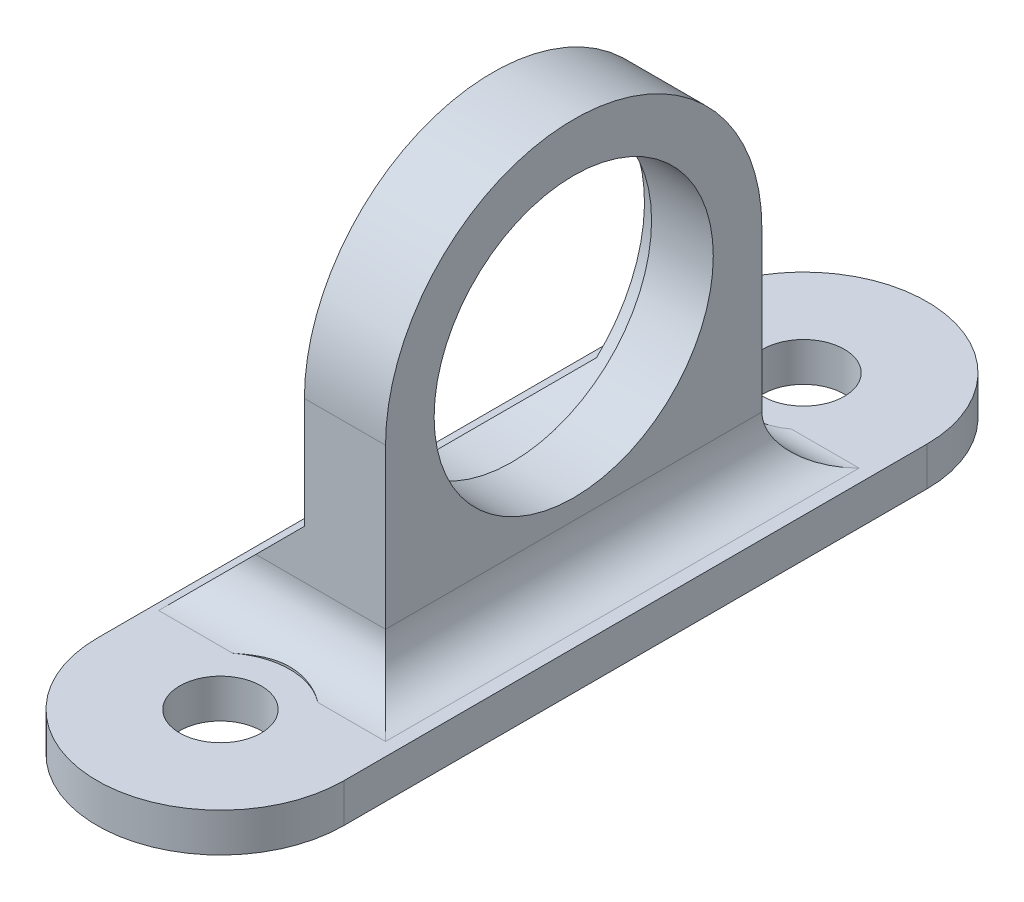
from build123d import *

# Parameters (mm, degrees)
SKETCH1_R                          = 19.3637
SKETCH1_R_2                        = 14.3637
MOTOR_FACE_AND_SCREW_EXTRUDE_DEPTH = 6.35
BOSS_EXTRUDE4_START                = 2
SKETCH7_R                          = 19.3637
SKETCH7_R_2                        = 15.6337
BOSS_EXTRUDE4_DEPTH                = 2
SKETCH3_R                          = 4.2
BOSS_EXTRUDE3_DEPTH                = 4
BOSS_EXTRUDE5_REACH                = 62.384
BOSS_EXTRUDE5_END_RADIUS           = 19.3637
SKETCH8_W                          = 8.35
SKETCH8_H                          = 38.7274
CHAMFER1_SIZE                      = 10
FILLET1_R                          = 5
SKETCH6_W                          = 7.14375
SKETCH6_H                          = 40.7637
F_1_0MM_DOWEL_HOLE1_AT_2_COUNT     = 2
F_1_0MM_DOWEL_HOLE1_AT_2_PITCH     = 60


with BuildPart() as part:
    # Sketch1 → Motor face and screw extrude (new body)
    with BuildSketch(Plane(origin=(0, 0, 0), x_dir=(0, 0, -1), z_dir=(1, 0, 0))):
        with Locations((0, -7)):
            Circle(SKETCH1_R)
        with Locations((0, -7)):
            Circle(SKETCH1_R_2, mode=Mode.SUBTRACT)
    extrude(amount=MOTOR_FACE_AND_SCREW_EXTRUDE_DEPTH)

    # Sketch7 → Boss-Extrude4 (add)
    with BuildSketch(Plane.ZY.offset(BOSS_EXTRUDE4_START)):
        with Locations((0, -7)):
            Circle(SKETCH7_R)
        with Locations((0, -7)):
            Circle(SKETCH7_R_2, mode=Mode.SUBTRACT)
    extrude(amount=-BOSS_EXTRUDE4_DEPTH)



with BuildPart() as body_2:
    # Sketch3 → Boss-Extrude3 (new body)
    with BuildSketch(Plane(origin=(0, -32.4, 0), x_dir=(1, 0, 0), z_dir=(0, 1, 0))):
        with BuildLine():
            Line((-12.7, -30), (-12.7, 30))
            ThreePointArc((-12.7, 30), (0, 42.7), (12.7, 30))
            Line((12.7, 30), (12.7, -30))
            ThreePointArc((12.7, -30), (0, -42.7), (-12.7, -30))
        make_face()
        with Locations(Location((0, 30, 0), (0, 0, 270))):
            Circle(SKETCH3_R, mode=Mode.SUBTRACT)
        with Locations(Location((0, -30, 0), (0, 0, 90))):
            Circle(SKETCH3_R, mode=Mode.SUBTRACT)
    extrude(amount=BOSS_EXTRUDE3_DEPTH)


with BuildPart() as part_1:
    add(part.part)

    add(body_2.part)  # Boss-Extrude5 merges body 2
    # Boss-Extrude5: up to this cylinder (the profile starts outside it)
    boss_extrude5_end = Plane(origin=(2.175, -7, 0), z_dir=(-1, 0, 0)) * Cylinder(BOSS_EXTRUDE5_END_RADIUS, 164.4954, mode=Mode.PRIVATE)
    # Sketch8 → Boss-Extrude5 (add, up to the surface)
    with BuildSketch(Plane(origin=(0, -28.4, 0), x_dir=(1, 0, 0), z_dir=(0, 1, 0)), mode=Mode.PRIVATE) as boss_extrude5_sk1:
        with Locations((2.175, 0)):
            Rectangle(SKETCH8_W, SKETCH8_H)
    boss_extrude5_tool1 = extrude(boss_extrude5_sk1.sketch, amount=BOSS_EXTRUDE5_REACH, mode=Mode.PRIVATE) - boss_extrude5_end
    add(boss_extrude5_tool1.solids().sort_by_distance((2.175, -28.4, 0))[0])

    # Chamfer1
    # the kernel refuses this chamfer: 10 mm, written as the material it adds along each edge
    with BuildSketch(Plane(origin=(-2, -28.4, -19.3637), x_dir=(-0.9996219169112968, -0.027495876610586317, 0), z_dir=(0, 0, 1))) as chamfer1_piece_1_section:
        Polygon((CHAMFER1_SIZE * 0.999621916911, -CHAMFER1_SIZE * 0.0274958766106), (-CHAMFER1_SIZE * 0.0274958766106, -CHAMFER1_SIZE * 0.999621916911), (0, 0), align=None)
    chamfer1_piece_1 = extrude(amount=38.7274, mode=Mode.PRIVATE)
    chamfer1_piece_1 = chamfer1_piece_1 - Plane(origin=(-3.620762983, -7, 0), x_dir=(0, 0, 1), z_dir=(-1, 0, 0)) * Cylinder(15.6337, 118, mode=Mode.PRIVATE)
    add(chamfer1_piece_1)

    # Fillet1
    fillet1_edges = [part_1.edges().sort_by_distance(p)[0] for p in [
        (-2.825, -28.4, -19.3637),
        (6.35, -28.4, 0),
        (-2.825, -28.4, 19.3637),
    ]]
    fillet(fillet1_edges, radius=FILLET1_R)

    # Sketch6 → Ø1.0mm Dowel Hole1 (revolve, cut)
    with BuildSketch(Plane(origin=(0, -28.4, 30), x_dir=(0, 0, -1), z_dir=(1, 0, 0))):
        with Locations((3.571875, 20.38185)):
            Rectangle(SKETCH6_W, SKETCH6_H)
    f_1_0mm_dowel_hole1 = revolve(axis=Axis((0, -34.75, 30), (0, 1, 0)), mode=Mode.SUBTRACT)

    # Ø1.0mm Dowel Hole1 at 2: Ø1.0mm Dowel Hole1 ×2
    with Locations(*[(0, 0, -i * F_1_0MM_DOWEL_HOLE1_AT_2_PITCH) for i in range(1, F_1_0MM_DOWEL_HOLE1_AT_2_COUNT)]):
        add(f_1_0mm_dowel_hole1, mode=Mode.SUBTRACT)


solid = part_1.part
